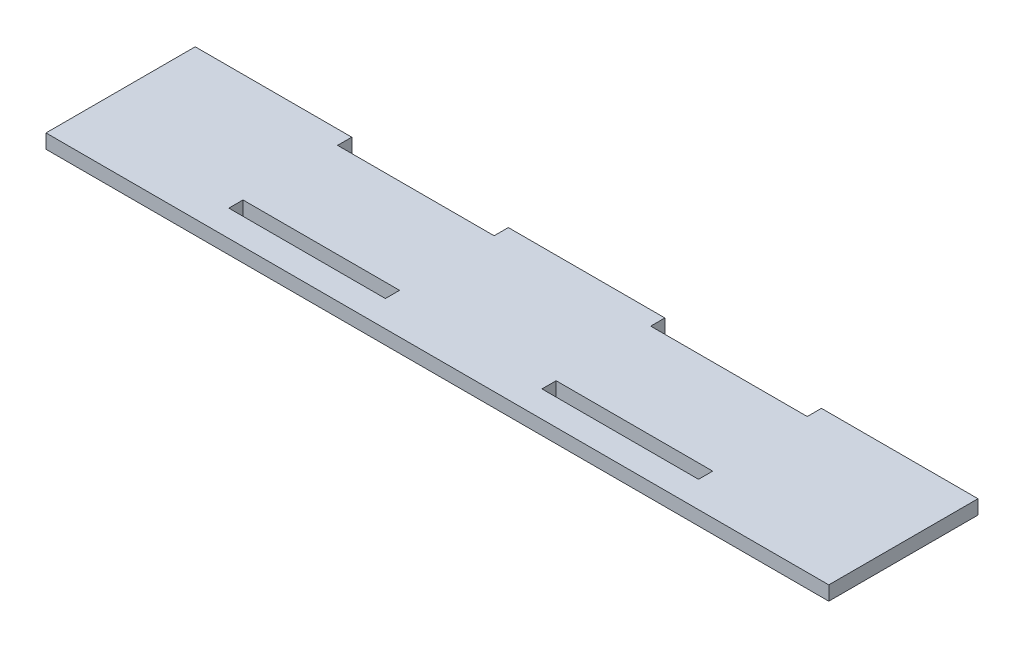
from build123d import *

# Parameters (mm, degrees)
SKETCH1_W           = 29.8
SKETCH1_H           = 2.7
BOSS_EXTRUDE1_DEPTH = 2.7


with BuildPart() as part:
    # Sketch1 → Boss-Extrude1 (new body)
    with BuildSketch(Plane(origin=(0, 0, 0), x_dir=(1, 0, 0), z_dir=(0, 1, 0))):
        Polygon((-74.5, -14.2), (74.5, -14.2), (74.5, 14.2), (44.7, 14.2), (44.7, 11.5), (14.9, 11.5), (14.9, 14.2), (-14.9, 14.2), (-14.9, 11.5), (-44.7, 11.5), (-44.7, 14.2), (-74.5, 14.2), align=None)
        with Locations((-29.8, -7.85)):
            Rectangle(SKETCH1_W, SKETCH1_H, mode=Mode.SUBTRACT)
        with Locations((29.8, -7.85)):
            Rectangle(SKETCH1_W, SKETCH1_H, mode=Mode.SUBTRACT)
    extrude(amount=BOSS_EXTRUDE1_DEPTH)


solid = part.part
